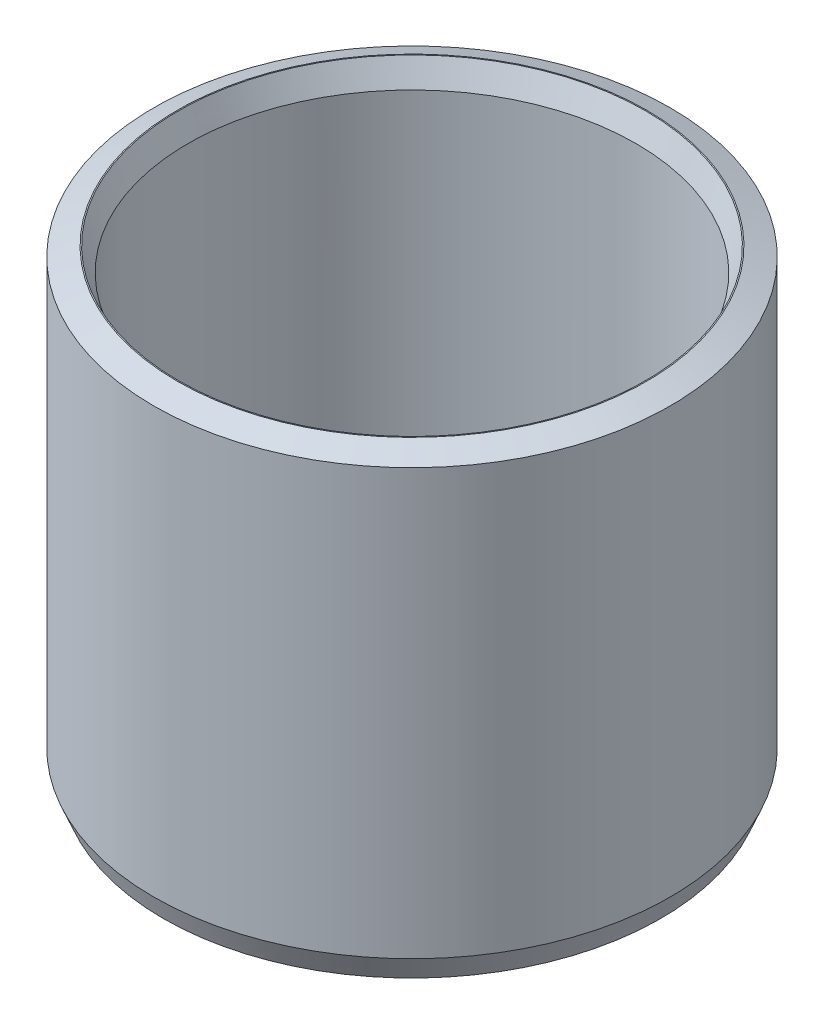
from build123d import *
from OCP.BRepFilletAPI import BRepFilletAPI_MakeChamfer

# Parameters (mm, degrees)
SKETCH1_R           = 42.5
BOSS_EXTRUDE1_DEPTH = 75.435899167
SKETCH2_R           = 36.865489661
CUT_EXTRUDE1_DEPTH  = 97.452448819
CHAMFER1_SIZE       = 1.583118972
CHAMFER1_SIZE2      = 3.869573108


with BuildPart() as part:
    # Sketch1 → Boss-Extrude1 (new body)
    with BuildSketch(Plane(origin=(0, 0, 0), x_dir=(1, 0, 0), z_dir=(0, 1, 0))):
        Circle(SKETCH1_R)
    extrude(amount=BOSS_EXTRUDE1_DEPTH)

    # Sketch2 → Cut-Extrude1 (cut, through all)
    with BuildSketch(Plane(origin=(0, 0, 0), x_dir=(1, 0, 0), z_dir=(0, 1, 0))):
        Circle(SKETCH2_R)
    extrude(amount=CUT_EXTRUDE1_DEPTH, mode=Mode.SUBTRACT)

    # Chamfer1: one chamfer whose edges measure the first distance from different faces: ONE call of the kernel's chamfer builder (chamfer() names one face for all edges)
    chamfer1_edges_1 = [part.edges().sort_by_distance(p)[0] for p in [
        (-36.865489661, 75.435899167, 0),
    ]]
    chamfer1_side_1 = [part.faces().sort_by_distance(p)[0] for p in [
        (-41.297918472, 75.435899167, 0),
    ]]
    chamfer1_edges_2 = [part.edges().sort_by_distance(p)[0] for p in [
        (-36.865489661, 0, 0),
    ]]
    chamfer1_side_2 = [part.faces().sort_by_distance(p)[0] for p in [
        (-36.865489661, 37.717949584, 0),
    ]]
    chamfer1_edges_3 = [part.edges().sort_by_distance(p)[0] for p in [
        (-42.5, 0, 0),
    ]]
    chamfer1_side_3 = [part.faces().sort_by_distance(p)[0] for p in [
        (-41.297918472, 0, 0),
    ]]
    chamfer1_edges_4 = [part.edges().sort_by_distance(p)[0] for p in [
        (-42.5, 75.435899167, 0),
    ]]
    chamfer1_side_4 = [part.faces().sort_by_distance(p)[0] for p in [
        (-42.5, 37.717949584, 0),
    ]]
    chamfer1 = BRepFilletAPI_MakeChamfer(part.part.solid().wrapped)
    for e in chamfer1_edges_1:
        chamfer1.Add(CHAMFER1_SIZE, CHAMFER1_SIZE2, e.wrapped, chamfer1_side_1[0].wrapped)  # the first distance lies on this face
    for e in chamfer1_edges_2:
        chamfer1.Add(CHAMFER1_SIZE, CHAMFER1_SIZE2, e.wrapped, chamfer1_side_2[0].wrapped)  # the first distance lies on this face
    for e in chamfer1_edges_3:
        chamfer1.Add(CHAMFER1_SIZE, CHAMFER1_SIZE2, e.wrapped, chamfer1_side_3[0].wrapped)  # the first distance lies on this face
    for e in chamfer1_edges_4:
        chamfer1.Add(CHAMFER1_SIZE, CHAMFER1_SIZE2, e.wrapped, chamfer1_side_4[0].wrapped)  # the first distance lies on this face
    add(Compound.cast(chamfer1.Shape()), mode=Mode.REPLACE)


solid = part.part
